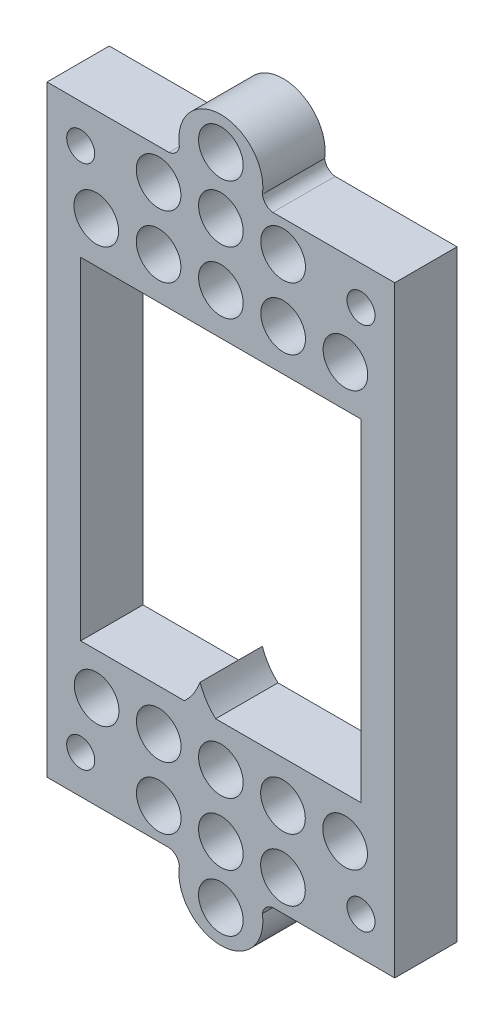
from build123d import *

# Parameters (mm, degrees)
SKETCH1_R           = 1.35
SKETCH1_R_2         = 2.15
BOSS_EXTRUDE1_DEPTH = 6
SKETCH2_R           = 2.15
CUT_EXTRUDE1_DEPTH  = 4.2


with BuildPart() as part:
    # Sketch1 → Boss-Extrude1 (new body)
    with BuildSketch(Plane.XY):
        with BuildLine():
            Line((-16.75, 29), (-5, 29))
            ThreePointArc((-5, 29), (-4.324155518, 29.324155518), (-4, 30))
            ThreePointArc((-4, 30), (0, 34.662885145), (4, 30))
            ThreePointArc((4, 30), (4.330169642, 29.330169642), (5, 29))
            Line((5, 29), (16.75, 29))
            Line((16.75, 29), (16.75, -29))
            Line((16.75, -29), (5, -29))
            ThreePointArc((5, -29), (4.330169642, -29.330169642), (4, -30))
            ThreePointArc((4, -30), (0, -34.662885145), (-4, -30))
            ThreePointArc((-4, -30), (-4.324155518, -29.324155518), (-5, -29))
            Line((-5, -29), (-16.75, -29))
            Line((-16.75, -29), (-16.75, 29))
        make_face()
        with Locations((-13.5, 25.3)):
            Circle(SKETCH1_R, mode=Mode.SUBTRACT)
        with Locations((13.5, -25.3)):
            Circle(SKETCH1_R, mode=Mode.SUBTRACT)
        with Locations((-13.5, -25.3)):
            Circle(SKETCH1_R, mode=Mode.SUBTRACT)
        with Locations((13.5, 25.3)):
            Circle(SKETCH1_R, mode=Mode.SUBTRACT)
        with Locations((0, 31.5)):
            Circle(SKETCH1_R_2, mode=Mode.SUBTRACT)
        with Locations((0, -31.5)):
            Circle(SKETCH1_R_2, mode=Mode.SUBTRACT)
        with BuildLine():
            Line((-13.5, 16), (13.5, 16))
            Line((13.5, 16), (13.5, -16))
            Line((13.5, -16), (-0.5, -16))
            ThreePointArc((-0.5, -16), (-1.396990669, -14.94586348), (-2, -13.7))
            ThreePointArc((-2, -13.7), (-2.615937149, -14.937432294), (-3.5, -16))
            Line((-3.5, -16), (-13.5, -16))
            Line((-13.5, -16), (-13.5, 16))
        make_face(mode=Mode.SUBTRACT)
    extrude(amount=BOSS_EXTRUDE1_DEPTH)

    # Sketch2 → Cut-Extrude1 (cut)
    with BuildSketch(Plane.XY.offset(6)):
        with Locations((-12, 20)):
            Circle(SKETCH2_R)
        with Locations((-6, 20)):
            Circle(SKETCH2_R)
        with Locations((0, 20)):
            Circle(SKETCH2_R)
        with Locations((6, 20)):
            Circle(SKETCH2_R)
        with Locations((12, 20)):
            Circle(SKETCH2_R)
        with Locations((-6, 26)):
            Circle(SKETCH2_R)
        with Locations((0, 26)):
            Circle(SKETCH2_R)
        with Locations((6, 26)):
            Circle(SKETCH2_R)
        with Locations((-11.967349369, -20)):
            Circle(SKETCH2_R)
        with Locations((-5.983674685, -20)):
            Circle(SKETCH2_R)
        with Locations((0, -20)):
            Circle(SKETCH2_R)
        with Locations((5.983674685, -20)):
            Circle(SKETCH2_R)
        with Locations((11.967349369, -20)):
            Circle(SKETCH2_R)
        with Locations((-5.983674685, -26)):
            Circle(SKETCH2_R)
        with Locations((0, -26)):
            Circle(SKETCH2_R)
        with Locations((5.983674685, -26)):
            Circle(SKETCH2_R)
    extrude(amount=-CUT_EXTRUDE1_DEPTH, mode=Mode.SUBTRACT)


solid = part.part
